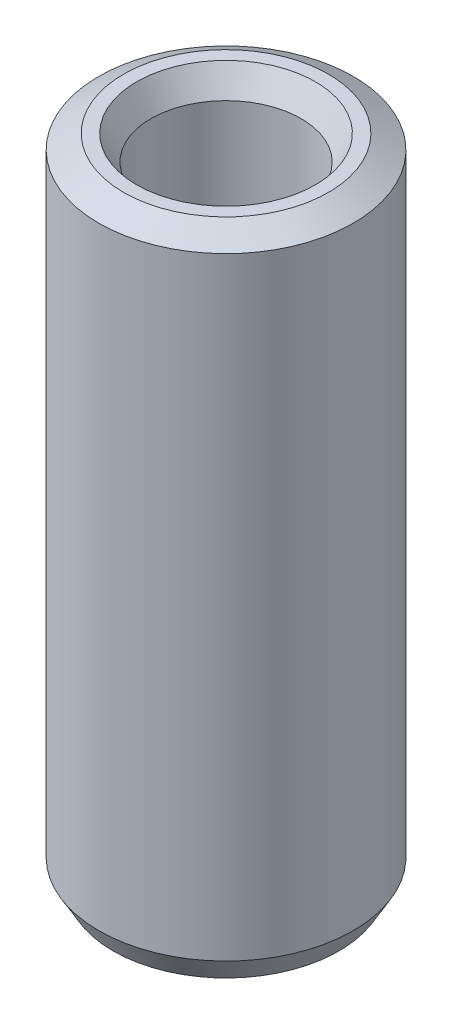
from build123d import *
from OCP.BRepFilletAPI import BRepFilletAPI_MakeChamfer

# Parameters (mm, degrees)
SKETCH1_R           = 12.5
BOSS_EXTRUDE1_DEPTH = 64.037781043
SKETCH2_R           = 7.37475101
CUT_EXTRUDE1_DEPTH  = 67.432954179
CHAMFER1_SIZE       = 1.404900413
CHAMFER1_SIZE2      = 2.433358895


with BuildPart() as part:
    # Sketch1 → Boss-Extrude1 (new body)
    with BuildSketch(Plane(origin=(0, 0, 0), x_dir=(1, 0, 0), z_dir=(0, 1, 0))):
        Circle(SKETCH1_R)
    extrude(amount=BOSS_EXTRUDE1_DEPTH)

    # Sketch2 → Cut-Extrude1 (cut, through all)
    with BuildSketch(Plane(origin=(0, 0, 0), x_dir=(1, 0, 0), z_dir=(0, 1, 0))):
        Circle(SKETCH2_R)
    extrude(amount=CUT_EXTRUDE1_DEPTH, mode=Mode.SUBTRACT)

    # Chamfer1: one chamfer whose edges measure the first distance from different faces: ONE call of the kernel's chamfer builder (chamfer() names one face for all edges)
    chamfer1_edges_1 = [part.edges().sort_by_distance(p)[0] for p in [
        (-7.37475101, 64.037781043, 0),
    ]]
    chamfer1_side_1 = [part.faces().sort_by_distance(p)[0] for p in [
        (-12.146446609, 64.037781043, 0),
    ]]
    chamfer1_edges_2 = [part.edges().sort_by_distance(p)[0] for p in [
        (-7.37475101, 0, 0),
    ]]
    chamfer1_side_2 = [part.faces().sort_by_distance(p)[0] for p in [
        (-7.37475101, 32.018890522, 0),
    ]]
    chamfer1_edges_3 = [part.edges().sort_by_distance(p)[0] for p in [
        (-12.5, 0, 0),
    ]]
    chamfer1_side_3 = [part.faces().sort_by_distance(p)[0] for p in [
        (-12.146446609, 0, 0),
    ]]
    chamfer1_edges_4 = [part.edges().sort_by_distance(p)[0] for p in [
        (-12.5, 64.037781043, 0),
    ]]
    chamfer1_side_4 = [part.faces().sort_by_distance(p)[0] for p in [
        (-12.5, 32.018890522, 0),
    ]]
    chamfer1 = BRepFilletAPI_MakeChamfer(part.part.solid().wrapped)
    for e in chamfer1_edges_1:
        chamfer1.Add(CHAMFER1_SIZE, CHAMFER1_SIZE2, e.wrapped, chamfer1_side_1[0].wrapped)  # the first distance lies on this face
    for e in chamfer1_edges_2:
        chamfer1.Add(CHAMFER1_SIZE, CHAMFER1_SIZE2, e.wrapped, chamfer1_side_2[0].wrapped)  # the first distance lies on this face
    for e in chamfer1_edges_3:
        chamfer1.Add(CHAMFER1_SIZE, CHAMFER1_SIZE2, e.wrapped, chamfer1_side_3[0].wrapped)  # the first distance lies on this face
    for e in chamfer1_edges_4:
        chamfer1.Add(CHAMFER1_SIZE, CHAMFER1_SIZE2, e.wrapped, chamfer1_side_4[0].wrapped)  # the first distance lies on this face
    add(Compound.cast(chamfer1.Shape()), mode=Mode.REPLACE)


solid = part.part
